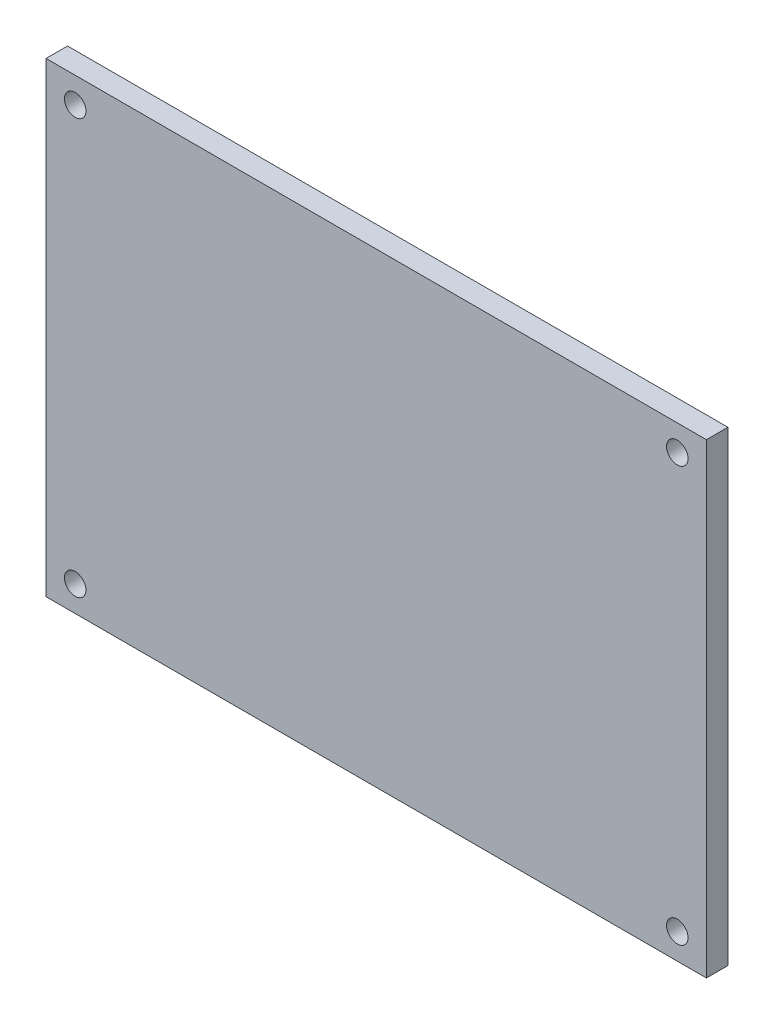
from build123d import *

# Parameters (mm, degrees)
SKETCH_1_W      = 92.075
SKETCH_1_H      = 65
SKETCH_1_R      = 1.5
EXTRUDE_1_DEPTH = 3


with BuildPart() as part:
    # 草图1 → 凸台-拉伸1 (new body)
    with BuildSketch(Plane.XY):
        Rectangle(SKETCH_1_W, SKETCH_1_H)
        with Locations((41.9735, -28.92)):
            Circle(SKETCH_1_R, mode=Mode.SUBTRACT)
        with Locations((41.9735, 28.92)):
            Circle(SKETCH_1_R, mode=Mode.SUBTRACT)
        with Locations((-41.9735, 28.92)):
            Circle(SKETCH_1_R, mode=Mode.SUBTRACT)
        with Locations((-41.9735, -28.92)):
            Circle(SKETCH_1_R, mode=Mode.SUBTRACT)
    extrude(amount=EXTRUDE_1_DEPTH)


solid = part.part
